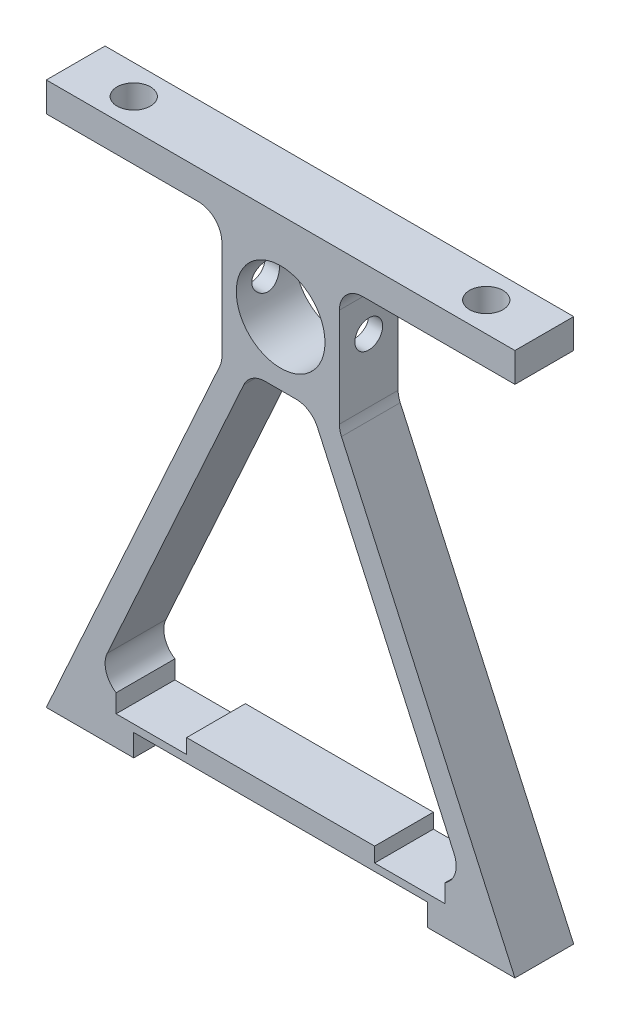
from build123d import *

# Parameters (mm, degrees)
SKETCH3_R               = 9.5885
BOSS_EXTRUDE1_DEPTH     = 12.7
SKETCH4_R               = 3.614257139
CUT_EXTRUDE1_DEPTH      = 6.35
CUT_EXTRUDE2_START      = -12.7
CUT_EXTRUDE2_OUTLINE_R  = 3
CUT_EXTRUDE2_DEPTH      = 25.4
CUT_EXTRUDE3_DEPTH      = 126.664030474
CUT_EXTRUDE3_DEPTH_BACK = 126.664030474
SKETCH8_W               = 15.24
SKETCH8_H               = 5.08


# Read off the part's stored shape, not the designer's step: Cut-Extrude2
with BuildPart() as part:
    # Sketch3 → Boss-Extrude1 (new body)
    with BuildSketch(Plane.XY):
        with BuildLine():
            Line((50.652428891, 3.175), (-50.652428891, 3.175))
            Line((-50.652428891, 3.175), (-50.652428891, -3.175))
            Line((-50.652428891, -3.175), (-17.78, -3.175))
            ThreePointArc((-17.78, -3.175), (-14.187897552, -4.662897552), (-12.7, -8.255))
            Line((-12.7, -8.255), (-12.7, -29.595434395))
            ThreePointArc((-12.7, -29.595434395), (-12.814872576, -30.66963627), (-13.154295145, -31.69525691))
            Line((-13.154295145, -31.69525691), (-50.652428891, -114.3))
            Line((-50.652428891, -114.3), (-31.75, -114.3))
            Line((-31.75, -114.3), (-31.75, -109.5375))
            Line((-31.75, -109.5375), (31.75, -109.5375))
            Line((31.75, -109.5375), (31.75, -114.3))
            Line((31.75, -114.3), (50.652428891, -114.3))
            Line((50.652428891, -114.3), (13.154295145, -31.69525691))
            ThreePointArc((13.154295145, -31.69525691), (12.814872576, -30.66963627), (12.7, -29.595434395))
            Line((12.7, -29.595434395), (12.7, -8.255))
            ThreePointArc((12.7, -8.255), (14.187897552, -4.662897552), (17.78, -3.175))
            Line((17.78, -3.175), (50.652428891, -3.175))
            Line((50.652428891, -3.175), (50.652428891, 3.175))
        make_face()
        with Locations((0, -15.875)):
            Circle(SKETCH3_R, mode=Mode.SUBTRACT)
        with BuildLine():
            Line((-7.97501727, -32.575611881), (-37.490421301, -97.595177486))
            ThreePointArc((-37.490421301, -97.595177486), (-37.135167146, -102.446299841), (-32.864716446, -104.775))
            Line((-32.864716446, -104.775), (0, -104.775))
            Line((0, -104.775), (32.864716446, -104.775))
            ThreePointArc((32.864716446, -104.775), (37.135167146, -102.446299841), (37.490421301, -97.595177486))
            Line((37.490421301, -97.595177486), (7.97501727, -32.575611881))
            ThreePointArc((7.97501727, -32.575611881), (6.100612256, -30.404983695), (3.349312415, -29.595434395))
            Line((3.349312415, -29.595434395), (-3.349312415, -29.595434395))
            ThreePointArc((-3.349312415, -29.595434395), (-6.100612256, -30.404983695), (-7.97501727, -32.575611881))
        make_face(mode=Mode.SUBTRACT)
    extrude(amount=BOSS_EXTRUDE1_DEPTH)

    # Sketch4 → Cut-Extrude1 (cut)
    with BuildSketch(Plane(origin=(0, 3.175, 0), x_dir=(1, 0, 0), z_dir=(0, 1, 0))):
        with Locations(Location((-38.1, -6.35, 0), (0, 0, 180))):
            Circle(SKETCH4_R)
        with Locations(Location((38.1, -6.35, 0), (0, 0, 180))):
            Circle(SKETCH4_R)
    extrude(amount=-CUT_EXTRUDE1_DEPTH, mode=Mode.SUBTRACT)

    # Cut-Extrude2 outline → Cut-Extrude2 (cut)
    with BuildSketch(Plane.YZ.offset(CUT_EXTRUDE2_START)):
        with Locations((-15.883331584, 6.35)):
            Circle(CUT_EXTRUDE2_OUTLINE_R)
    extrude(amount=CUT_EXTRUDE2_DEPTH, mode=Mode.SUBTRACT)

    # Sketch8 → Cut-Extrude3 (cut, two sides: drawn at the far end of the back side and taken through both)
    with BuildSketch(Plane.XY.offset(12.7).offset(-CUT_EXTRUDE3_DEPTH_BACK)):
        with Locations((-27.94, -105.41)):
            Rectangle(SKETCH8_W, SKETCH8_H)
        with Locations((27.94, -105.41)):
            Rectangle(SKETCH8_W, SKETCH8_H)
    extrude(amount=CUT_EXTRUDE3_DEPTH + CUT_EXTRUDE3_DEPTH_BACK, mode=Mode.SUBTRACT)


solid = part.part
